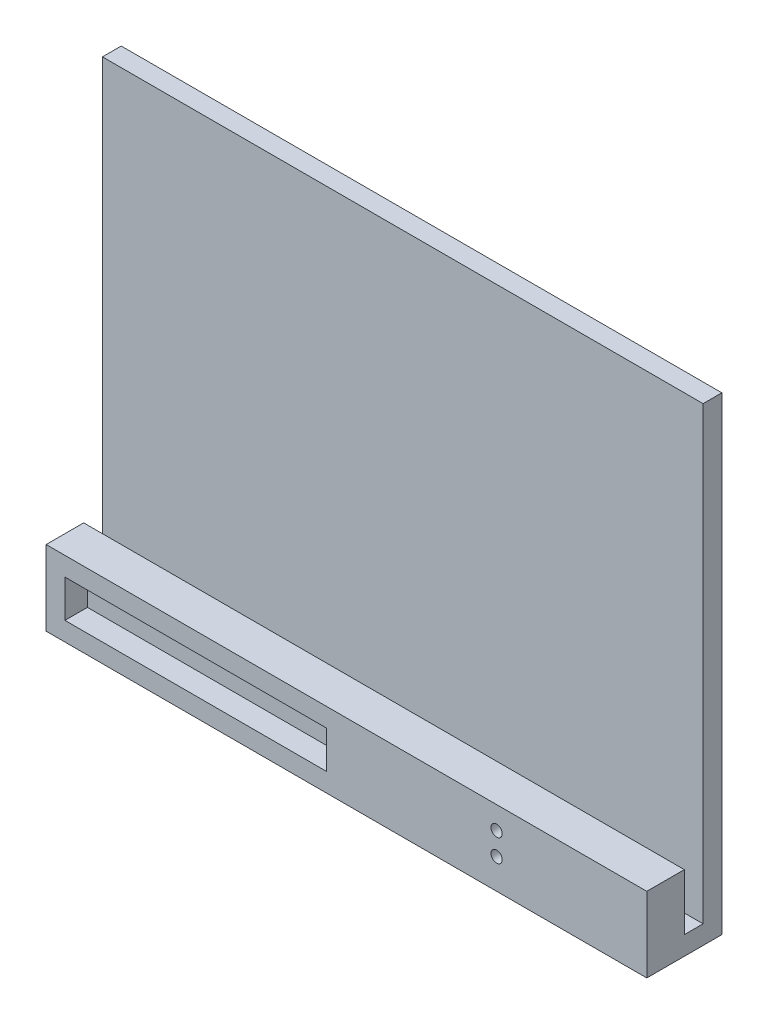
from build123d import *

# Parameters (mm, degrees)
SKETCH1_W           = 203.2
SKETCH1_H           = 158.75
BOSS_EXTRUDE1_DEPTH = 6.35
SKETCH2_W           = 203.2
SKETCH2_H           = 6.35
BOSS_EXTRUDE2_DEPTH = 19.05
SKETCH3_W           = 203.2
SKETCH3_H           = 12.7
BOSS_EXTRUDE3_DEPTH = 19.05
SKETCH4_W           = 88.555771164
SKETCH4_H           = 12.7
CUT_EXTRUDE1_DEPTH  = 7.62
CUT_EXTRUDE2_REACH  = 261.108
SKETCH5_R           = 1.905


with BuildPart() as part:
    # Sketch1 → Boss-Extrude1 (new body)
    with BuildSketch(Plane.XY):
        with Locations((101.6, 79.375)):
            Rectangle(SKETCH1_W, SKETCH1_H)
    extrude(amount=BOSS_EXTRUDE1_DEPTH)

    # Sketch2 → Boss-Extrude2 (add)
    with BuildSketch(Plane.XY.offset(6.35)):
        with Locations((101.6, 3.175)):
            Rectangle(SKETCH2_W, SKETCH2_H)
    extrude(amount=BOSS_EXTRUDE2_DEPTH)

    # Sketch3 → Boss-Extrude3 (add)
    with BuildSketch(Plane(origin=(0, 6.35, 0), x_dir=(1, 0, 0), z_dir=(0, 1, 0))):
        with Locations((101.6, -19.05)):
            Rectangle(SKETCH3_W, SKETCH3_H)
    extrude(amount=BOSS_EXTRUDE3_DEPTH)

    # Sketch4 → Cut-Extrude1 (cut)
    with BuildSketch(Plane.XY.offset(25.4)):
        with Locations((50.627885582, 12.7)):
            Rectangle(SKETCH4_W, SKETCH4_H)
    extrude(amount=-CUT_EXTRUDE1_DEPTH, mode=Mode.SUBTRACT)

    # Sketch5 → Cut-Extrude2 (cut, up to next)
    with BuildSketch(Plane.XY.offset(25.4), mode=Mode.PRIVATE) as cut_extrude2_sk1:
        with Locations((152.4, 17.78)):
            Circle(SKETCH5_R)
    cut_extrude2_tool1 = extrude(cut_extrude2_sk1.sketch, amount=-CUT_EXTRUDE2_REACH, mode=Mode.PRIVATE) & part.part
    # Sketch5 → Cut-Extrude2 (cut, up to next)
    with BuildSketch(Plane.XY.offset(25.4), mode=Mode.PRIVATE) as cut_extrude2_sk2:
        with Locations((152.4, 10.16)):
            Circle(SKETCH5_R)
    cut_extrude2_tool2 = extrude(cut_extrude2_sk2.sketch, amount=-CUT_EXTRUDE2_REACH, mode=Mode.PRIVATE) & part.part
    add(cut_extrude2_tool1.solids().sort_by_distance((152.4, 17.78, 25.4))[0], mode=Mode.SUBTRACT)
    add(cut_extrude2_tool2.solids().sort_by_distance((152.4, 10.16, 25.4))[0], mode=Mode.SUBTRACT)


solid = part.part
